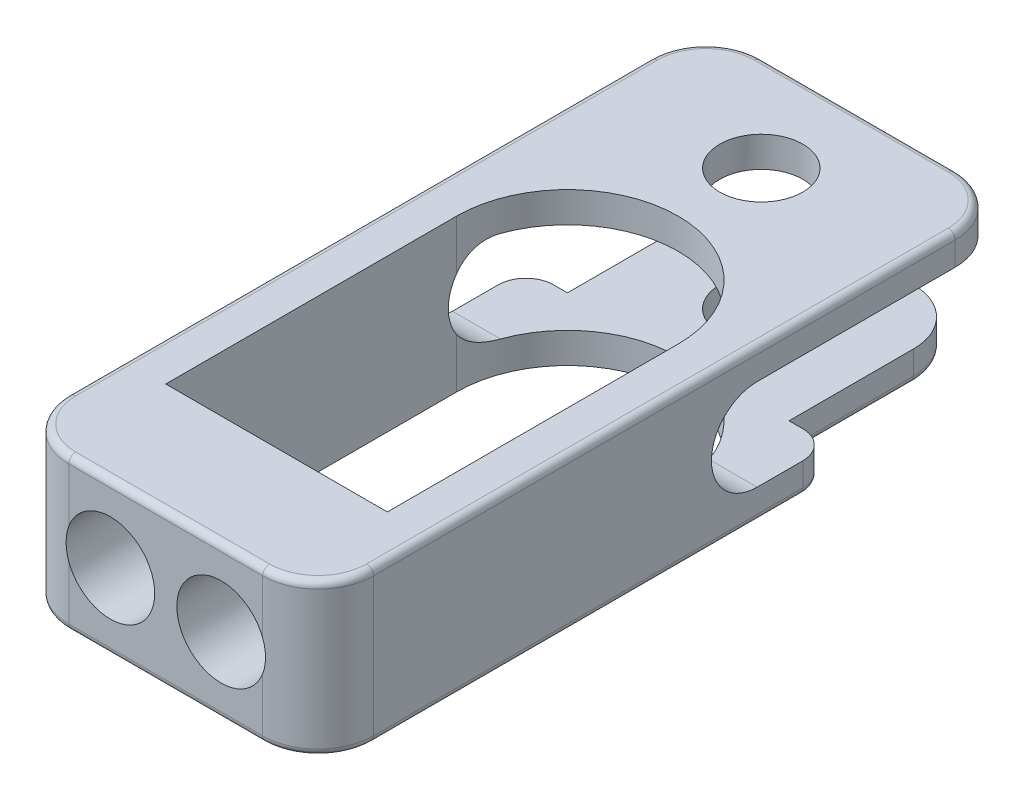
from build123d import *

# Parameters (mm, degrees)
SALIENTE_EXTRUIR1_DEPTH         = 11
DI_METRO_DE_TALADRO_6_0_6_1_D   = 6
CORTAR_EXTRUIR1_DEPTH           = 36.071355834
CROQUIS6_W                      = 4.933877459
CROQUIS6_H                      = 16.455327893
CROQUIS6_W_2                    = 4.832675104
CORTAR_EXTRUIR5_DEPTH           = 4
REDONDEO1_R                     = 4
REDONDEO2_R                     = 4
REDONDEO3_R                     = 2
REDONDEO4_R                     = 0.5
DI_METRO_DE_TALADRO_6_4_6_4_1_D = 6.4


with BuildPart() as part:
    # Croquis1 → Saliente-Extruir1 (new body)
    with BuildSketch(Plane(origin=(0, 0, 0), x_dir=(1, 0, 0), z_dir=(0, 1, 0))):
        with BuildLine():
            Line((-7, 25), (7, 25))
            ThreePointArc((7, 25), (9.828427125, 23.828427125), (11, 21))
            Line((11, 21), (11, -21))
            ThreePointArc((11, -21), (9.828427125, -23.828427125), (7, -25))
            Line((7, -25), (-7, -25))
            ThreePointArc((-7, -25), (-9.828427125, -23.828427125), (-11, -21))
            Line((-11, -21), (-11, 21))
            ThreePointArc((-11, 21), (-9.828427125, 23.828427125), (-7, 25))
        make_face()
        with BuildLine():
            Line((-8, -17), (8, -17))
            Line((8, -17), (8, 4))
            ThreePointArc((8, 4), (0, 12), (-8, 4))
            Line((-8, 4), (-8, -17))
        make_face(mode=Mode.SUBTRACT)
    extrude(amount=-SALIENTE_EXTRUIR1_DEPTH)

    # Diámetro de taladro Ø6.0 (6)1 (through all)
    with Locations(Plane(origin=(0, 0, 0), x_dir=(1, 0, 0), z_dir=(0, 1, 0))):
        with Locations((0, 18)):
            Hole(DI_METRO_DE_TALADRO_6_0_6_1_D / 2)

    # Croquis5 → Cortar-Extruir1 (cut, through all)
    with BuildSketch(Plane(origin=(11, 0, 0), x_dir=(0, 0, -1), z_dir=(1, 0, 0))):
        with BuildLine():
            Line((6.7, -2.2), (26.063321608, -2.2))
            Line((26.063321608, -2.2), (26.063321608, -8.8))
            Line((26.063321608, -8.8), (6.7, -8.8))
            ThreePointArc((6.7, -8.8), (3.4, -5.5), (6.7, -2.2))
        make_face()
    extrude(amount=-CORTAR_EXTRUIR1_DEPTH, mode=Mode.SUBTRACT)

    # Croquis6 → Cortar-Extruir5 (cut)
    with BuildSketch(Plane.XZ.offset(11)):
        with Locations((10.46693873, -20.227663947)):
            Rectangle(CROQUIS6_W, CROQUIS6_H)
        with Locations((-10.416337552, -20.227663947)):
            Rectangle(CROQUIS6_W_2, CROQUIS6_H)
    extrude(amount=-CORTAR_EXTRUIR5_DEPTH, mode=Mode.SUBTRACT)

    # Redondeo1
    # the kernel refuses this fillet: 4 mm, written as the material it takes off along each edge
    with BuildSketch(Plane(origin=(8, -21.005040364, -24.872983346), x_dir=(-0.9994962175029386, 0, -0.031738166256391975), z_dir=(0, 1, 0))) as redondeo1_piece_1:
        with BuildLine():
            CenterArc((3.875063481, 3.99798487), REDONDEO1_R, 181.818768407, 90)
            Line((-0.122921389, 3.871032205), (-0.522719876, 3.858336938))
            Line((-0.522719876, 3.858336938), (-0.399798487, -0.012695267))
            Line((-0.399798487, -0.012695267), (-0.087657483, -0.390277037))
            ThreePointArc((-0.087657483, -0.390277037), (1.01622276, -0.495012986), (4.014711412, -0.399798487))
            Line((4.014711412, -0.399798487), (4.002016146, 0))
        make_face()
    extrude(amount=12.205040364, mode=Mode.SUBTRACT)

    # Redondeo2
    # the kernel refuses this fillet: 4 mm, written as the material it takes off along each edge
    with BuildSketch(Plane(origin=(-8, -21.005040364, -24.872983346), x_dir=(0, 0, 1), z_dir=(0, 1, 0))) as redondeo2_piece_1:
        with BuildLine():
            CenterArc((3.872983346, 4), REDONDEO2_R, 180, 90)
            Line((-0.127016654, 4), (-0.527016654, 4))
            ThreePointArc((-0.527016654, 4), (-0.527016654, 1), (-0.387298335, -0.1))
            Line((-0.387298335, -0.1), (0, -0.4))
            Line((0, -0.4), (3.872983346, -0.4))
            Line((3.872983346, -0.4), (3.872983346, 0))
        make_face()
    extrude(amount=12.205040364, mode=Mode.SUBTRACT)

    # Redondeo3
    redondeo3_edges = [part.edges().sort_by_distance(p)[0] for p in [
        (-11, -9.9, -12),
        (11, -9.9, -12),
    ]]
    fillet(redondeo3_edges, radius=REDONDEO3_R)

    # Redondeo4
    redondeo4_edges = [part.edges().sort_by_distance(p)[0] for p in [
        (9.828427125, -11, 23.828427125),
        (0, 0, 25),
        (-9.828427125, 0, 23.828427125),
        (-8.5, -11, -12),
        (0, -11, -25),
        (6.828427125, -11, -23.828427125),
        (-8, -11, -16.5),
        (11, -11, 5.5),
        (-6.828427125, -11, -23.828427125),
        (-11, -11, 5.5),
        (8.5, -11, -12),
        (10.414213562, -11, -11.414213562),
        (-10.414213562, -11, -11.414213562),
        (-9.828427125, -11, 23.828427125),
        (0, -11, 25),
        (-11, 0, 0),
        (-9.828427125, 0, -23.828427125),
        (0, 0, -25),
        (8, -11, -16.5),
        (9.828427125, 0, -23.828427125),
        (11, 0, 0),
        (9.828427125, 0, 23.828427125),
    ]]
    fillet(redondeo4_edges, radius=REDONDEO4_R)

    # Diámetro de taladro Ø6.4 (6.4)1 (through all)
    with Locations(Plane.XY.offset(25)):
        with Locations((-4, -5.5), (4, -5.5)):
            Hole(DI_METRO_DE_TALADRO_6_4_6_4_1_D / 2)


solid = part.part
